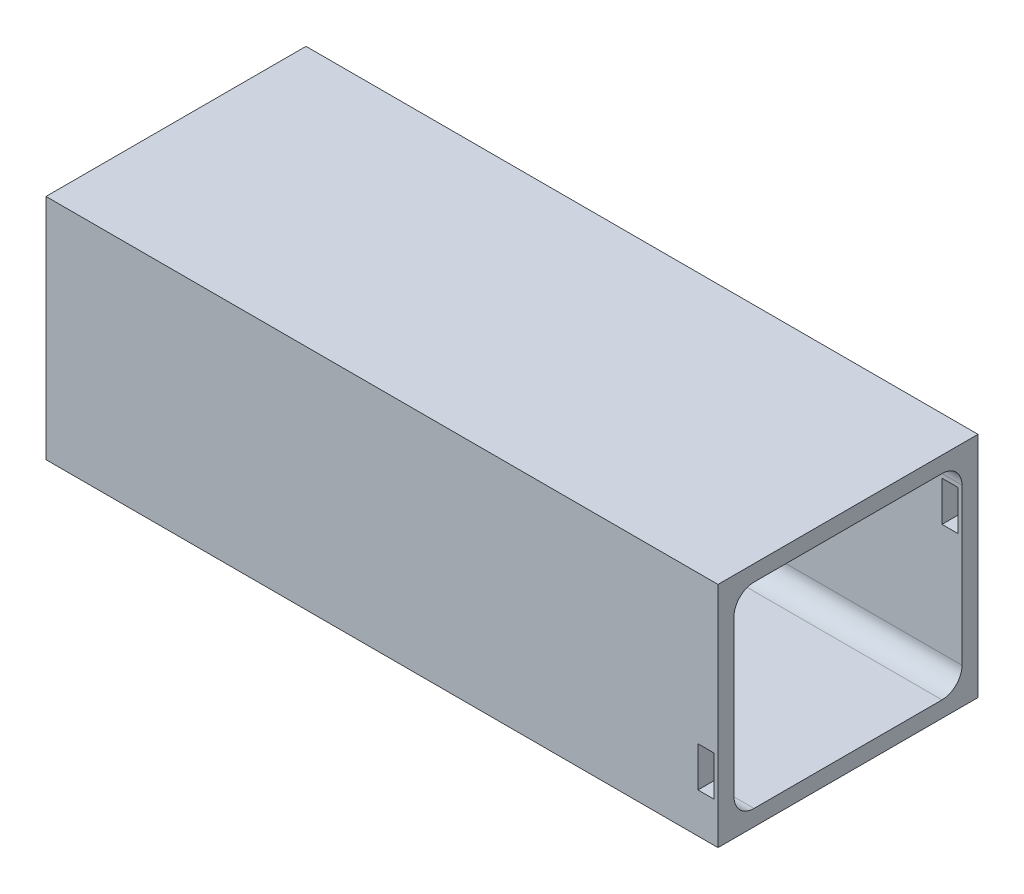
from build123d import *

# Parameters (mm, degrees)
SKETCH_1_W          = 65
SKETCH_1_H          = 57
EXTRUDE_1_DEPTH     = 167
SKETCH_2_W          = 4
SKETCH_2_H          = 10
CUT_EXTRUDE_1_DEPTH = 10
SKETCH_3_W          = 65
SKETCH_3_H          = 57
EXTRUDE_2_DEPTH     = 1
SKETCH_4_W          = 4
SKETCH_4_H          = 10
CUT_EXTRUDE_2_DEPTH = 10
SKETCH_5_W          = 1.8
SKETCH_5_H          = 3
SKETCH_5_W_2        = 0.5
SKETCH_5_H_2        = 1.5
EXTRUDE_3_DEPTH     = 2


with BuildPart() as part:
    # Эскиз1 → Бобышка-Вытянуть1 (new body)
    with BuildSketch(Plane(origin=(0, 0, 0), x_dir=(0, 0, -1), z_dir=(1, 0, 0))):
        Rectangle(SKETCH_1_W, SKETCH_1_H)
        with BuildLine():
            Line((23.5, -24.5), (-23.5, -24.5))
            ThreePointArc((-23.5, -24.5), (-27.035533906, -23.035533906), (-28.5, -19.5))
            Line((-28.5, -19.5), (-28.5, 19.5))
            ThreePointArc((-28.5, 19.5), (-27.035533906, 23.035533906), (-23.5, 24.5))
            Line((-23.5, 24.5), (23.5, 24.5))
            ThreePointArc((23.5, 24.5), (27.035533906, 23.035533906), (28.5, 19.5))
            Line((28.5, 19.5), (28.5, -19.5))
            ThreePointArc((28.5, -19.5), (27.035533906, -23.035533906), (23.5, -24.5))
        make_face(mode=Mode.SUBTRACT)
    extrude(amount=-EXTRUDE_1_DEPTH)

    # Эскиз2 → Вырез-Вытянуть1 (cut)
    with BuildSketch(Plane.XY.offset(32.5)):
        with Locations((-3, -13.5)):
            Rectangle(SKETCH_2_W, SKETCH_2_H)
    extrude(amount=-CUT_EXTRUDE_1_DEPTH, mode=Mode.SUBTRACT)

    # Эскиз3 → Бобышка-Вытянуть2 (add)
    with BuildSketch(Plane.ZY.offset(167)):
        Rectangle(SKETCH_3_W, SKETCH_3_H)
    extrude(amount=EXTRUDE_2_DEPTH)

    # Эскиз4 → Вырез-Вытянуть2 (cut)
    with BuildSketch(Plane(origin=(0, 0, -32.5), x_dir=(-1, 0, 0), z_dir=(0, 0, -1))):
        with Locations((3, 13.5)):
            Rectangle(SKETCH_4_W, SKETCH_4_H)
    extrude(amount=-CUT_EXTRUDE_2_DEPTH, mode=Mode.SUBTRACT)

    # Эскиз5 → Бобышка-Вытянуть3 (add)
    with BuildSketch(Plane(origin=(-167, 0, 0), x_dir=(0, 0, -1), z_dir=(1, 0, 0))):
        with Locations((-21.6, -23)):
            Rectangle(SKETCH_5_W, SKETCH_5_H)
        with Locations((-17.8, -23)):
            Rectangle(SKETCH_5_W, SKETCH_5_H)
        with Locations((-13.15, -23.75)):
            Rectangle(SKETCH_5_W_2, SKETCH_5_H_2)
        with Locations((-14.65, -23.75)):
            Rectangle(SKETCH_5_W_2, SKETCH_5_H_2)
        with Locations((-11.65, -23.75)):
            Rectangle(SKETCH_5_W_2, SKETCH_5_H_2)
        with Locations((-10.15, -23.75)):
            Rectangle(SKETCH_5_W_2, SKETCH_5_H_2)
        with Locations((-8.65, -23.75)):
            Rectangle(SKETCH_5_W_2, SKETCH_5_H_2)
        with Locations((-7.15, -23.75)):
            Rectangle(SKETCH_5_W_2, SKETCH_5_H_2)
        with Locations((-5.65, -23.75)):
            Rectangle(SKETCH_5_W_2, SKETCH_5_H_2)
    extrude(amount=EXTRUDE_3_DEPTH)


solid = part.part
